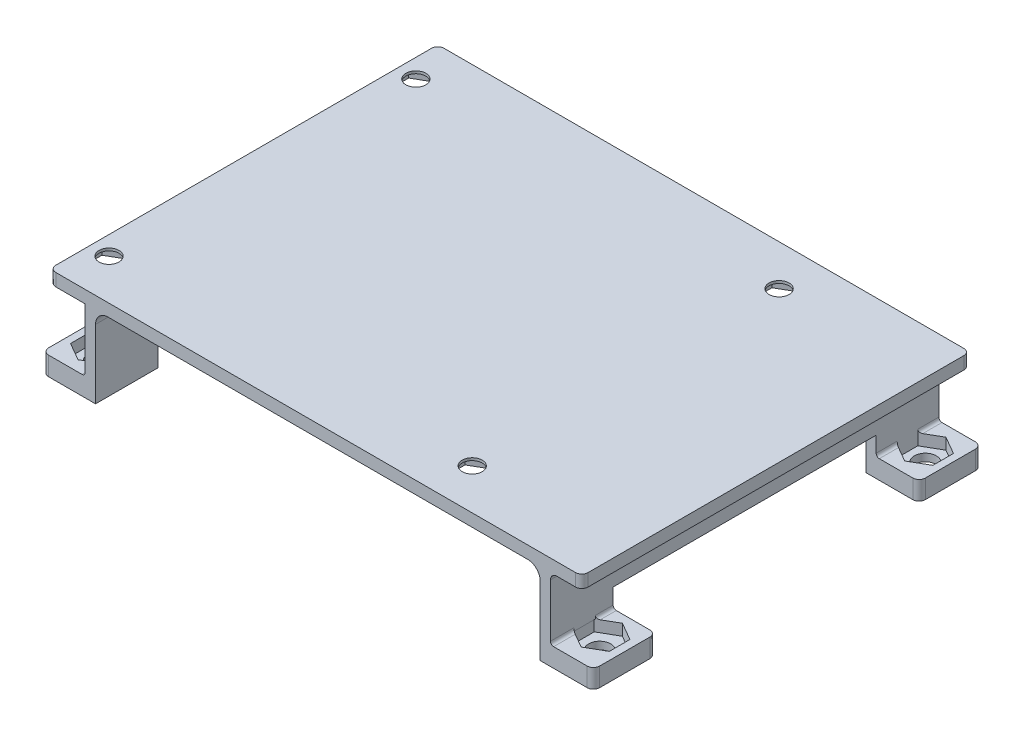
from build123d import *

# Parameters (mm, degrees)
EXTRUDE_1_DEPTH          = 31
CUT_EXTRUDE_1_DEPTH      = 56.874860179
CUT_EXTRUDE_1_DEPTH_BACK = 56.874860179
SKETCH_2_W               = 42
SKETCH_2_H               = 12
CUT_EXTRUDE_3_REACH      = 57.875
SKETCH_3_R               = 1.75
SKETCH_5_R               = 1.6
CUT_EXTRUDE_5_DEPTH      = 5
CUT_EXTRUDE_8_DEPTH      = 1.6
FILLET_1_R               = 1
FILLET_7_R               = 2
CUT_EXTRUDE_9_DEPTH      = 1.8
FILLET_5_R               = 0.5
FILLET_8_R               = 1


with BuildPart() as part:
    # 草圖1 → 填料-伸長1 (new, symmetric)
    with BuildSketch(Plane.XY):
        Polygon((-44, 0), (-44, 3), (-37.15, 3), (-37.15, 13), (-42.85, 13), (-42.85, 15), (42.15, 15), (42.15, 13), (37.15, 13), (37.15, 3), (44, 3), (44, 0), (35.5, 0), (35.5, 13), (-35.5, 13), (-35.5, 0), align=None)
    extrude(amount=EXTRUDE_1_DEPTH, both=True)

    # 草圖2 → 除料-伸長1 (cut, two sides: drawn at the far end of the back side and taken through both)
    with BuildSketch(Plane(origin=(0, 0, 0), x_dir=(0, 0, -1), z_dir=(1, 0, 0)).offset(-CUT_EXTRUDE_1_DEPTH_BACK)):
        Rectangle(SKETCH_2_W, SKETCH_2_H)
    extrude(amount=CUT_EXTRUDE_1_DEPTH + CUT_EXTRUDE_1_DEPTH_BACK, mode=Mode.SUBTRACT)

    # 草圖3 → 除料-伸長3 (cut, up to next)
    with BuildSketch(Plane(origin=(0, 0, 0), x_dir=(1, 0, 0), z_dir=(0, 1, 0)), mode=Mode.PRIVATE) as cut_extrude_3_sk1:
        with Locations((-40, 26)):
            Circle(SKETCH_3_R)
    cut_extrude_3_tool1 = extrude(cut_extrude_3_sk1.sketch, amount=CUT_EXTRUDE_3_REACH, mode=Mode.PRIVATE) & part.part
    # 草圖3 → 除料-伸長3 (cut, up to next)
    with BuildSketch(Plane(origin=(0, 0, 0), x_dir=(1, 0, 0), z_dir=(0, 1, 0)), mode=Mode.PRIVATE) as cut_extrude_3_sk2:
        with Locations((40, 26)):
            Circle(SKETCH_3_R)
    cut_extrude_3_tool2 = extrude(cut_extrude_3_sk2.sketch, amount=CUT_EXTRUDE_3_REACH, mode=Mode.PRIVATE) & part.part
    # 草圖3 → 除料-伸長3 (cut, up to next)
    with BuildSketch(Plane(origin=(0, 0, 0), x_dir=(1, 0, 0), z_dir=(0, 1, 0)), mode=Mode.PRIVATE) as cut_extrude_3_sk3:
        with Locations((40, -26)):
            Circle(SKETCH_3_R)
    cut_extrude_3_tool3 = extrude(cut_extrude_3_sk3.sketch, amount=CUT_EXTRUDE_3_REACH, mode=Mode.PRIVATE) & part.part
    # 草圖3 → 除料-伸長3 (cut, up to next)
    with BuildSketch(Plane(origin=(0, 0, 0), x_dir=(1, 0, 0), z_dir=(0, 1, 0)), mode=Mode.PRIVATE) as cut_extrude_3_sk4:
        with Locations((-40, -26)):
            Circle(SKETCH_3_R)
    cut_extrude_3_tool4 = extrude(cut_extrude_3_sk4.sketch, amount=CUT_EXTRUDE_3_REACH, mode=Mode.PRIVATE) & part.part
    add(cut_extrude_3_tool1.solids().sort_by_distance((-40, 0, -26))[0], mode=Mode.SUBTRACT)
    add(cut_extrude_3_tool2.solids().sort_by_distance((40, 0, -26))[0], mode=Mode.SUBTRACT)
    add(cut_extrude_3_tool3.solids().sort_by_distance((40, 0, 26))[0], mode=Mode.SUBTRACT)
    add(cut_extrude_3_tool4.solids().sort_by_distance((-40, 0, 26))[0], mode=Mode.SUBTRACT)

    # 草圖5 → 除料-伸長5 (cut)
    with BuildSketch(Plane(origin=(0, 15, 0), x_dir=(1, 0, 0), z_dir=(0, 1, 0))):
        with Locations((-39.85, 24.5)):
            Circle(SKETCH_5_R)
        with Locations((-39.85, -24.5)):
            Circle(SKETCH_5_R)
        with Locations((18.15, 24.5)):
            Circle(SKETCH_5_R)
        with Locations((18.15, -24.5)):
            Circle(SKETCH_5_R)
    extrude(amount=-CUT_EXTRUDE_5_DEPTH, mode=Mode.SUBTRACT)

    # 草圖17 → 除料-伸長8 (cut)
    with BuildSketch(Plane.XZ.offset(-13)):
        Polygon((20.85, 22.941154273), (20.85, 26.058845727), (18.15, 27.617691454), (15.45, 26.058845727), (15.45, 22.941154273), (18.15, 21.382308546), align=None)
        Polygon((20.85, -26.058845727), (20.85, -22.941154273), (18.15, -21.382308546), (15.45, -22.941154273), (15.45, -26.058845727), (18.15, -27.617691454), align=None)
        Polygon((-39.85, 21.382308546), (-37.15, 22.941154273), (-37.15, 26.058845727), (-39.85, 27.617691454), (-42.55, 26.058845727), (-42.55, 22.941154273), align=None)
        Polygon((-39.85, -27.617691454), (-37.15, -26.058845727), (-37.15, -22.941154273), (-39.85, -21.382308546), (-42.55, -22.941154273), (-42.55, -26.058845727), align=None)
    extrude(amount=-CUT_EXTRUDE_8_DEPTH, mode=Mode.SUBTRACT)

    # 圓角1
    fillet_1_edges = [part.edges().sort_by_distance(p)[0] for p in [
        (42.15, 14, -31),
        (44, 1.5, -31),
        (44, 1.5, -21),
        (44, 1.5, 21),
        (44, 1.5, 31),
        (42.15, 14, 31),
        (-42.85, 14, -31),
        (-44, 1.5, -31),
        (-44, 1.5, -21),
        (-44, 1.5, 21),
        (-44, 1.5, 31),
        (-42.85, 14, 31),
    ]]
    fillet(fillet_1_edges, radius=FILLET_1_R)

    # 圓角7
    fillet_7_edges = [part.edges().sort_by_distance(p)[0] for p in [
        (35.5, 13, 0),
        (-35.5, 13, 0),
    ]]
    fillet(fillet_7_edges, radius=FILLET_7_R)

    # 草圖19 → 除料-伸長9 (cut)
    with BuildSketch(Plane(origin=(0, 3, 0), x_dir=(1, 0, 0), z_dir=(0, 1, 0))):
        Polygon((-40, -29.290896534), (-37.15, -27.645448267), (-37.15, -24.354551733), (-40, -22.709103466), (-42.85, -24.354551733), (-42.85, -27.645448267), align=None)
        Polygon((39.896071136, -28.850899892), (42.746071136, -27.205451625), (42.746071136, -23.91455509), (39.896071136, -22.269106823), (37.046071136, -23.91455509), (37.046071136, -27.205451625), align=None)
        Polygon((42.85, 24.354551733), (42.85, 27.645448267), (40, 29.290896534), (37.15, 27.645448267), (37.15, 24.354551733), (40, 22.709103466), align=None)
        Polygon((-40, 22.709103466), (-37.15, 24.354551733), (-37.15, 27.645448267), (-40, 29.290896534), (-42.85, 27.645448267), (-42.85, 24.354551733), align=None)
    extrude(amount=-CUT_EXTRUDE_9_DEPTH, mode=Mode.SUBTRACT)

    # 圓角5
    fillet_5_edges = [part.edges().sort_by_distance(p)[0] for p in [
        (37.15, 3, -22.677275866),
        (37.15, 3, -29.322724134),
        (37.15, 3, 29.132727491),
        (37.15, 3, 22.427275866),
        (-37.15, 3, -22.677275866),
        (-37.15, 3, -29.322724134),
        (-37.15, 3, 22.677275866),
        (-37.15, 3, 29.322724134),
    ]]
    fillet(fillet_5_edges, radius=FILLET_5_R)

    # 圓角8
    fillet_8_edges = [part.edges().sort_by_distance(p)[0] for p in [
        (37.15, 13, 0),
    ]]
    fillet(fillet_8_edges, radius=FILLET_8_R)


solid = part.part
